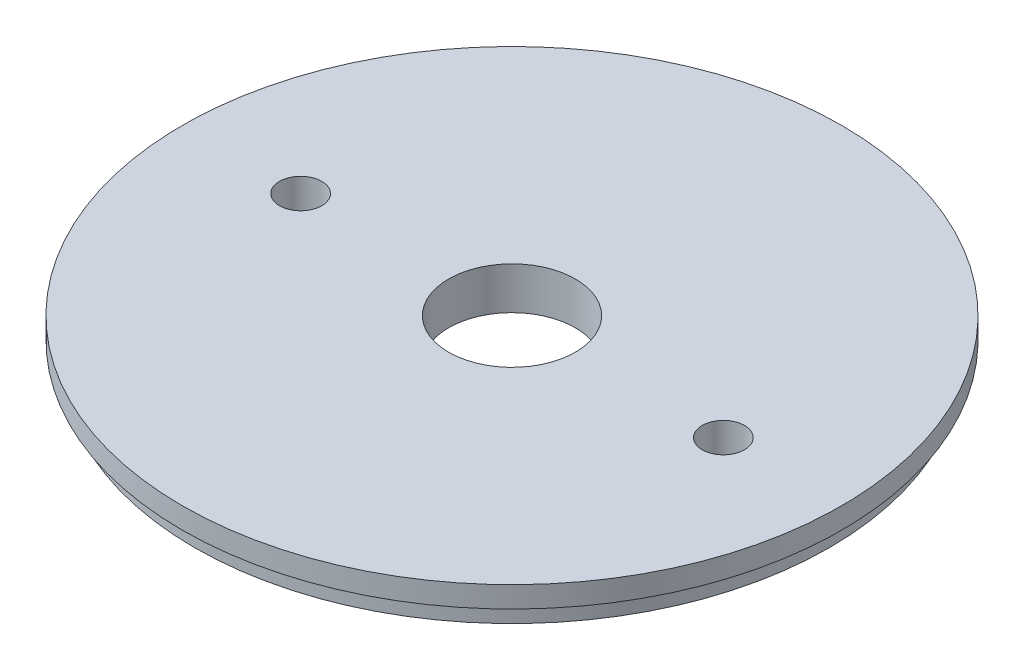
from build123d import *

# Parameters (mm, degrees)
SKETCH1_R           = 47.6885
BOSS_EXTRUDE1_DEPTH = 3.175
SKETCH2_R           = 49.5046
BOSS_EXTRUDE2_DEPTH = 3.175
SKETCH3_R           = 3.175
SKETCH3_R_2         = 9.525
CUT_EXTRUDE1_DEPTH  = 71.297463271


with BuildPart() as part:
    # Sketch1 → Boss-Extrude1 (new body)
    with BuildSketch(Plane(origin=(0, 0, 0), x_dir=(1, 0, 0), z_dir=(0, 1, 0))):
        Circle(SKETCH1_R)
    extrude(amount=BOSS_EXTRUDE1_DEPTH)

    # Sketch2 → Boss-Extrude2 (add)
    with BuildSketch(Plane(origin=(0, 3.175, 0), x_dir=(1, 0, 0), z_dir=(0, 1, 0))):
        Circle(SKETCH2_R)
    extrude(amount=BOSS_EXTRUDE2_DEPTH)

    # Sketch3 → Cut-Extrude1 (cut, through all)
    with BuildSketch(Plane(origin=(0, 6.35, 0), x_dir=(1, 0, 0), z_dir=(0, 1, 0))):
        with Locations((-31.75, 0)):
            Circle(SKETCH3_R)
        with Locations((31.75, 0)):
            Circle(SKETCH3_R)
        Circle(SKETCH3_R_2)
    extrude(amount=-CUT_EXTRUDE1_DEPTH, mode=Mode.SUBTRACT)


solid = part.part
